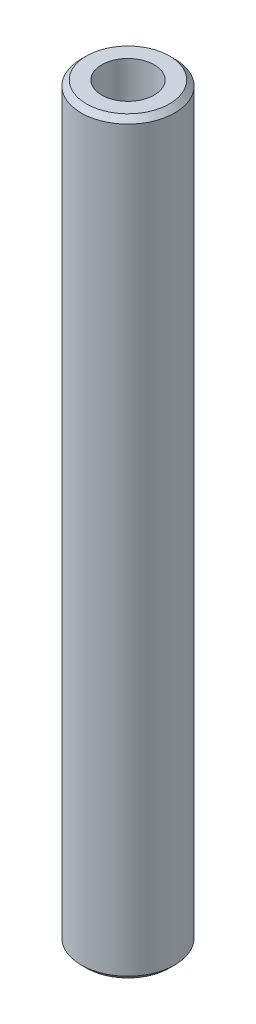
from build123d import *

# Parameters (mm, degrees)
SKETCH1_R           = 37.5
BOSS_EXTRUDE1_DEPTH = 600
SKETCH2_R           = 21.056708138
CUT_EXTRUDE1_DEPTH  = 603.339190158
CHAMFER1_SIZE       = 4.205534169


with BuildPart() as part:
    # Sketch1 → Boss-Extrude1 (new body)
    with BuildSketch(Plane(origin=(0, 0, 0), x_dir=(1, 0, 0), z_dir=(0, 1, 0))):
        Circle(SKETCH1_R)
    extrude(amount=BOSS_EXTRUDE1_DEPTH)

    # Sketch2 → Cut-Extrude1 (cut, through all)
    with BuildSketch(Plane(origin=(0, 0, 0), x_dir=(1, 0, 0), z_dir=(0, 1, 0))):
        Circle(SKETCH2_R)
    extrude(amount=CUT_EXTRUDE1_DEPTH, mode=Mode.SUBTRACT)

    # Chamfer1
    chamfer1_edges = [part.edges().sort_by_distance(p)[0] for p in [
        (-37.5, 600, 0),
        (-37.5, 0, 0),
    ]]
    chamfer(chamfer1_edges, length=CHAMFER1_SIZE)


solid = part.part
